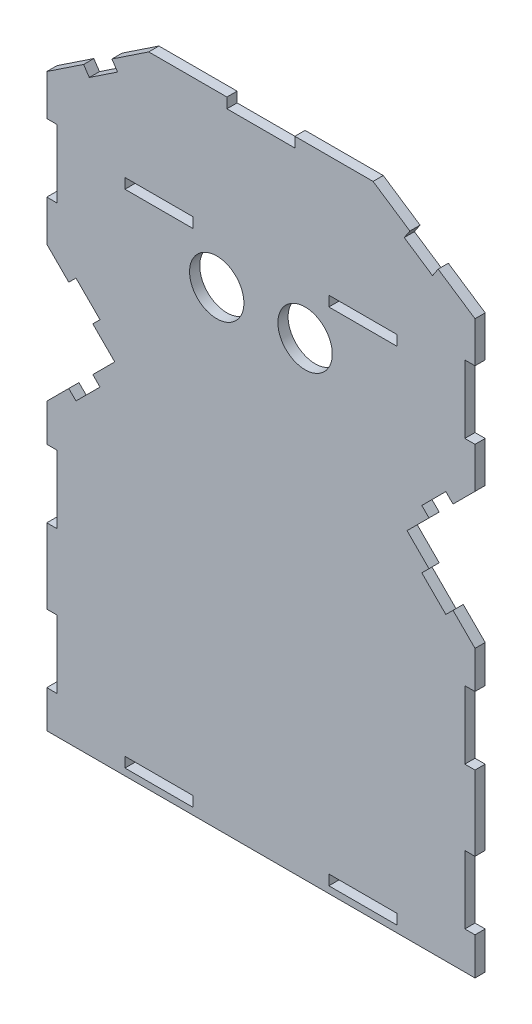
from build123d import *

# Parameters (mm, degrees)
SKETCH1_R           = 8
SKETCH1_W           = 20
SKETCH1_H           = 3
BOSS_EXTRUDE1_DEPTH = 3


with BuildPart() as part:
    # Sketch1 → Boss-Extrude1 (new body)
    with BuildSketch(Plane.XY):
        Polygon((62.274694919, 0), (62.274694919, -11), (59.274694919, -11), (59.274694919, -31), (62.274694919, -31), (62.274694919, -53), (59.274694919, -53), (59.274694919, -73), (62.274694919, -73), (62.274694919, -84), (-63.725305081, -84), (-63.725305081, -73), (-60.725305081, -73), (-60.725305081, -53), (-63.725305081, -53), (-63.725305081, -31), (-60.725305081, -31), (-60.725305081, -11), (-63.725305081, -11), (-63.725305081, 0), (-57.260838987, 6.464466094), (-55.139518643, 4.343145751), (-48.068450831, 11.414213562), (-50.189771175, 13.535533906), (-43.725305081, 20), (-50.189771175, 26.464466094), (-48.068450831, 28.585786438), (-55.139518643, 35.656854249), (-57.260838987, 33.535533906), (-63.725305081, 40), (-63.725305081, 52), (-60.725305081, 52), (-60.725305081, 72), (-63.725305081, 72), (-63.725305081, 84), (-52.885556553, 91.226499019), (-51.221455964, 88.730348136), (-42.90095302, 94.277350098), (-44.565053609, 96.773500981), (-33.725305081, 104), (-10.725305081, 104), (-10.725305081, 101), (9.274694919, 101), (9.274694919, 104), (32.274694919, 104), (43.114443447, 96.773500981), (41.450342859, 94.277350098), (49.770845802, 88.730348136), (51.434946391, 91.226499019), (62.274694919, 84), (62.274694919, 72), (59.274694919, 72), (59.274694919, 52), (62.274694919, 52), (62.274694919, 40), (55.810228825, 33.535533906), (53.688908482, 35.656854249), (46.61784067, 28.585786438), (48.739161013, 26.464466094), (42.274694919, 20), (48.739161013, 13.535533906), (46.61784067, 11.414213562), (53.688908482, 4.343145751), (55.810228825, 6.464466094), align=None)
        with Locations((-13.725305081, 54)):
            Circle(SKETCH1_R, mode=Mode.SUBTRACT)
        with Locations((12.274694919, 54)):
            Circle(SKETCH1_R, mode=Mode.SUBTRACT)
        with Locations((29.274694919, -80.5)):
            Rectangle(SKETCH1_W, SKETCH1_H, mode=Mode.SUBTRACT)
        with Locations((-30.725305081, -80.5)):
            Rectangle(SKETCH1_W, SKETCH1_H, mode=Mode.SUBTRACT)
        with Locations((29.274694919, 67)):
            Rectangle(SKETCH1_W, SKETCH1_H, mode=Mode.SUBTRACT)
        with Locations((-30.725305081, 67)):
            Rectangle(SKETCH1_W, SKETCH1_H, mode=Mode.SUBTRACT)
    extrude(amount=BOSS_EXTRUDE1_DEPTH)


solid = part.part
